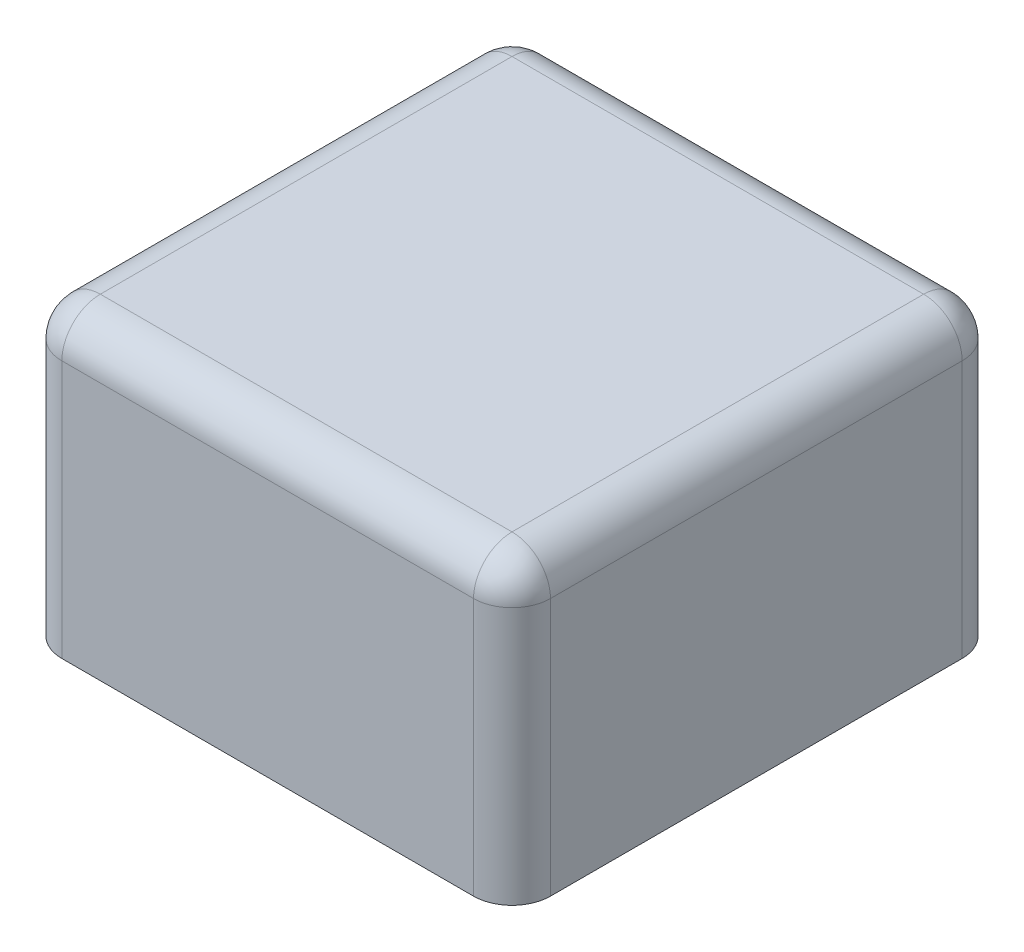
from build123d import *

# Parameters (mm, degrees)
SKETCH1_W           = 25.4
SKETCH1_H           = 25.4
BOSS_EXTRUDE1_DEPTH = 15.4
FILLET1_R           = 2


with BuildPart() as part:
    # Sketch1 → Boss-Extrude1 (new body)
    with BuildSketch(Plane(origin=(0, 0, 0), x_dir=(1, 0, 0), z_dir=(0, 1, 0))):
        Rectangle(SKETCH1_W, SKETCH1_H)
    extrude(amount=BOSS_EXTRUDE1_DEPTH)

    # Fillet1
    fillet1_edges = [part.edges().sort_by_distance(p)[0] for p in [
        (12.7, 7.7, -12.7),
        (12.7, 15.4, 0),
        (0, 15.4, -12.7),
        (-12.7, 7.7, -12.7),
        (12.7, 7.7, 12.7),
        (0, 15.4, 12.7),
        (-12.7, 7.7, 12.7),
        (-12.7, 15.4, 0),
    ]]
    fillet(fillet1_edges, radius=FILLET1_R)


solid = part.part
